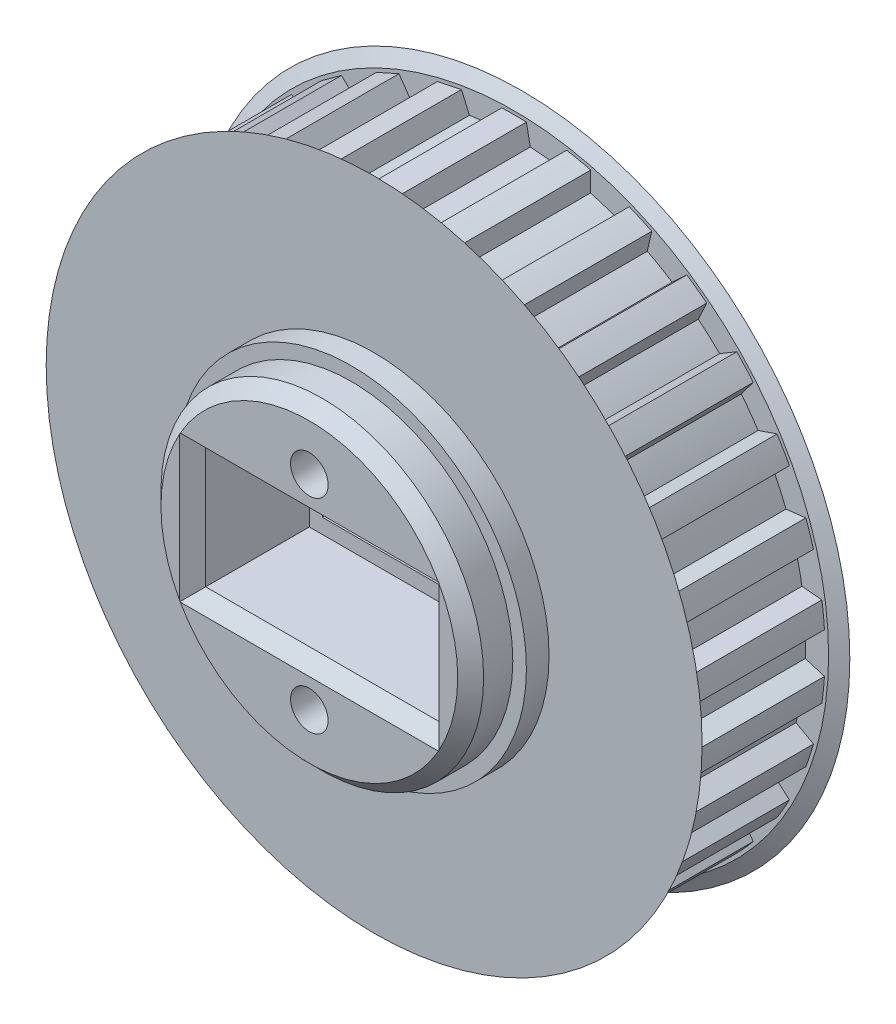
from build123d import *
from build123d.topology import SkipClean

# Parameters (mm, degrees)
CROQUIS1_R                 = 1.5
SALIENTE_EXTRUIR1_DEPTH    = 10.2
CROQUIS2_R                 = 26
CROQUIS2_R_2               = 1.5
SALIENTE_EXTRUIR2_DEPTH    = 0.6
SALIENTE_EXTRUIR4_START    = 4.25
CROQUIS4_R                 = 12.45
CROQUIS4_R_2               = 1.5
SALIENTE_EXTRUIR4_DEPTH    = 4.25
SALIENTE_EXTRUIR6_START    = 0.6
CROQUIS6_R                 = 26
CROQUIS6_R_2               = 1.5
SALIENTE_EXTRUIR6_DEPTH    = 0.6
SALIENTE_EXTRUIR5_START    = 1.75
CROQUIS5_R                 = 13.5
CROQUIS5_R_2               = 1.5
SALIENTE_EXTRUIR5_DEPTH    = 1.75
CHAFL_N2_SIZE              = 1.732050808
CHAFL_N2_SIZE_2            = 1
CROQUIS3_R                 = 12.45
CROQUIS3_R_2               = 1.5
SALIENTE_EXTRUIR7_DEPTH    = 5
CHAFL_N4_SIZE              = 1
CROQUIS7_R                 = 13.5
CROQUIS7_R_2               = 1.5
SALIENTE_EXTRUIR8_DEPTH    = 1.75
CORTAR_EXTRUIR1_DEPTH      = 40.122201962
CORTAR_EXTRUIR1_DEPTH_BACK = 40.122201962
CROQUIS8_R                 = 1.45
CROQUIS8_W                 = 16
CROQUIS8_H                 = 7
CROQUIS10_W                = 18
CROQUIS10_H                = 9.3
CORTAR_EXTRUIR3_DEPTH      = 9
CHAFL_N5_SIZE              = 1
SKETCH1_R                  = 12.45
SKETCH1_R_2                = 1.45
BOSS_EXTRUDE1_DEPTH        = 5
SKETCH2_R                  = 1.45
CUT_EXTRUDE1_DEPTH         = 42.023276154
SKETCH4_W                  = 8
SKETCH4_H                  = 7
CUT_EXTRUDE2_DEPTH         = 21
CHAMFER3_SIZE              = 1
CHAMFER2_SIZE              = 0.75


# Some blends are built 0.0001 mm under size
with BuildPart() as part:
    # Croquis1 → Saliente-Extruir1 (new body)
    with BuildSketch(Plane.XY):
        with BuildLine():
            Line((-0.95, 23.981190546), (-1.25, 22.465250945))
            ThreePointArc((-1.25, 22.465250945), (-2.351890424, 22.376742646), (-3.448103808, 22.234220925))
            Line((-3.448103808, 22.234220925), (-4.056729654, 23.654660102))
            Line((-4.056729654, 23.654660102), (-5.915210095, 23.259627889))
            Line((-5.915210095, 23.259627889), (-5.893472809, 21.714441698))
            ThreePointArc((-5.893472809, 21.714441698), (-6.952882373, 21.398771617), (-7.995508933, 21.031448759))
            Line((-7.995508933, 21.031448759), (-8.886160755, 22.294307503))
            Line((-8.886160755, 22.294307503), (-10.621897124, 21.521507881))
            Line((-10.621897124, 21.521507881), (-10.279372577, 20.014607151))
            ThreePointArc((-10.279372577, 20.014607151), (-11.25, 19.485571585), (-12.193471951, 18.909501362))
            Line((-12.193471951, 18.909501362), (-13.327223991, 19.959586687))
            Line((-13.327223991, 19.959586687), (-14.86435628, 18.842794707))
            Line((-14.86435628, 18.842794707), (-14.216014437, 17.440038232))
            ThreePointArc((-14.216014437, 17.440038232), (-15.055438643, 16.720758573), (-15.858521735, 15.961118018))
            Line((-15.858521735, 15.961118018), (-17.185823587, 16.752536155))
            Line((-17.185823587, 16.752536155), (-18.457171739, 15.340560987))
            Line((-18.457171739, 15.340560987), (-17.53134825, 14.103255955))
            ThreePointArc((-17.53134825, 14.103255955), (-18.202882373, 13.225168177), (-18.83047802, 12.315157227))
            Line((-18.83047802, 12.315157227), (-20.293320226, 12.813319407))
            ThreePointArc((-20.293320226, 12.813319407), (-20.784609691, 12), (-21.243320226, 11.167871139))
            Line((-21.243320226, 11.167871139), (-20.08047802, 10.150093718))
            ThreePointArc((-20.08047802, 10.150093718), (-20.554772797, 9.151574469), (-20.979452058, 8.13096497))
            Line((-20.979452058, 8.13096497), (-22.513901393, 8.314099115))
            ThreePointArc((-22.513901393, 8.314099115), (-22.825356391, 7.416407865), (-23.101033682, 6.507091734))
            Line((-23.101033682, 6.507091734), (-21.751994544, 5.753323679))
            ThreePointArc((-21.751994544, 5.753323679), (-22.008321017, 4.678013043), (-22.21152337, 3.591410527))
            Line((-22.21152337, 3.591410527), (-23.750517035, 3.451512796))
            ThreePointArc((-23.750517035, 3.451512796), (-23.868525489, 2.508683118), (-23.949121115, 1.561921194))
            Line((-23.949121115, 1.561921194), (-22.472844528, 1.105105789))
            ThreePointArc((-22.472844528, 1.105105789), (-22.5, 0), (-22.472844528, -1.105105789))
            Line((-22.472844528, -1.105105789), (-23.949121115, -1.561921194))
            ThreePointArc((-23.949121115, -1.561921194), (-23.868525489, -2.508683118), (-23.750517035, -3.451512796))
            Line((-23.750517035, -3.451512796), (-22.21152337, -3.591410527))
            ThreePointArc((-22.21152337, -3.591410527), (-22.008321017, -4.678013043), (-21.751994544, -5.753323679))
            Line((-21.751994544, -5.753323679), (-23.101033682, -6.507091734))
            ThreePointArc((-23.101033682, -6.507091734), (-22.825356391, -7.416407865), (-22.513901393, -8.314099115))
            Line((-22.513901393, -8.314099115), (-20.979452058, -8.13096497))
            ThreePointArc((-20.979452058, -8.13096497), (-20.554772797, -9.151574469), (-20.08047802, -10.150093718))
            Line((-20.08047802, -10.150093718), (-21.243320226, -11.167871139))
            ThreePointArc((-21.243320226, -11.167871139), (-20.784609691, -12), (-20.293320226, -12.813319407))
            Line((-20.293320226, -12.813319407), (-18.83047802, -12.315157227))
            ThreePointArc((-18.83047802, -12.315157227), (-18.202882373, -13.225168177), (-17.53134825, -14.103255955))
            Line((-17.53134825, -14.103255955), (-18.457171739, -15.340560987))
            ThreePointArc((-18.457171739, -15.340560987), (-17.835475811, -16.059134553), (-17.185823587, -16.752536155))
            Line((-17.185823587, -16.752536155), (-15.858521735, -15.961118018))
            ThreePointArc((-15.858521735, -15.961118018), (-15.055438643, -16.720758573), (-14.216014437, -17.440038232))
            Line((-14.216014437, -17.440038232), (-14.86435628, -18.842794707))
            ThreePointArc((-14.86435628, -18.842794707), (-14.106846055, -19.416407865), (-13.327223991, -19.959586687))
            Line((-13.327223991, -19.959586687), (-12.193471951, -18.909501362))
            ThreePointArc((-12.193471951, -18.909501362), (-11.25, -19.485571585), (-10.279372577, -20.014607151))
            Line((-10.279372577, -20.014607151), (-10.621897124, -21.521507881))
            ThreePointArc((-10.621897124, -21.521507881), (-9.761679434, -21.925090983), (-8.886160755, -22.294307503))
            Line((-8.886160755, -22.294307503), (-7.995508933, -21.031448759))
            ThreePointArc((-7.995508933, -21.031448759), (-6.952882373, -21.398771617), (-5.893472809, -21.714441698))
            Line((-5.893472809, -21.714441698), (-5.915210095, -23.259627889))
            ThreePointArc((-5.915210095, -23.259627889), (-4.98988058, -23.475542418), (-4.056729654, -23.654660102))
            Line((-4.056729654, -23.654660102), (-3.448103808, -22.234220925))
            ThreePointArc((-3.448103808, -22.234220925), (-2.351890424, -22.376742646), (-1.25, -22.465250945))
            Line((-1.25, -22.465250945), (-0.95, -23.981190546))
            ThreePointArc((-0.95, -23.981190546), (0, -24), (0.95, -23.981190546))
            Line((0.95, -23.981190546), (1.25, -22.465250945))
            ThreePointArc((1.25, -22.465250945), (2.351890424, -22.376742646), (3.448103808, -22.234220925))
            Line((3.448103808, -22.234220925), (4.056729654, -23.654660102))
            ThreePointArc((4.056729654, -23.654660102), (4.98988058, -23.475542418), (5.915210095, -23.259627889))
            Line((5.915210095, -23.259627889), (5.893472809, -21.714441698))
            ThreePointArc((5.893472809, -21.714441698), (6.952882373, -21.398771617), (7.995508933, -21.031448759))
            Line((7.995508933, -21.031448759), (8.886160755, -22.294307503))
            ThreePointArc((8.886160755, -22.294307503), (9.761679434, -21.925090983), (10.621897124, -21.521507881))
            Line((10.621897124, -21.521507881), (10.279372577, -20.014607151))
            ThreePointArc((10.279372577, -20.014607151), (11.25, -19.485571585), (12.193471951, -18.909501362))
            Line((12.193471951, -18.909501362), (13.327223991, -19.959586687))
            ThreePointArc((13.327223991, -19.959586687), (14.106846055, -19.416407865), (14.86435628, -18.842794707))
            Line((14.86435628, -18.842794707), (14.216014437, -17.440038232))
            ThreePointArc((14.216014437, -17.440038232), (15.055438643, -16.720758573), (15.858521735, -15.961118018))
            Line((15.858521735, -15.961118018), (17.185823587, -16.752536155))
            ThreePointArc((17.185823587, -16.752536155), (17.835475811, -16.059134553), (18.457171739, -15.340560987))
            Line((18.457171739, -15.340560987), (17.53134825, -14.103255955))
            ThreePointArc((17.53134825, -14.103255955), (18.202882373, -13.225168177), (18.83047802, -12.315157227))
            Line((18.83047802, -12.315157227), (20.293320226, -12.813319407))
            ThreePointArc((20.293320226, -12.813319407), (20.784609691, -12), (21.243320226, -11.167871139))
            Line((21.243320226, -11.167871139), (20.08047802, -10.150093718))
            ThreePointArc((20.08047802, -10.150093718), (20.554772797, -9.151574469), (20.979452058, -8.13096497))
            Line((20.979452058, -8.13096497), (22.513901393, -8.314099115))
            ThreePointArc((22.513901393, -8.314099115), (22.825356391, -7.416407865), (23.101033682, -6.507091734))
            Line((23.101033682, -6.507091734), (21.751994544, -5.753323679))
            ThreePointArc((21.751994544, -5.753323679), (22.008321017, -4.678013043), (22.21152337, -3.591410527))
            Line((22.21152337, -3.591410527), (23.750517035, -3.451512796))
            ThreePointArc((23.750517035, -3.451512796), (23.868525489, -2.508683118), (23.949121115, -1.561921194))
            Line((23.949121115, -1.561921194), (22.472844528, -1.105105789))
            ThreePointArc((22.472844528, -1.105105789), (22.5, 0), (22.472844528, 1.105105789))
            Line((22.472844528, 1.105105789), (23.949121115, 1.561921194))
            ThreePointArc((23.949121115, 1.561921194), (23.868525489, 2.508683118), (23.750517035, 3.451512796))
            Line((23.750517035, 3.451512796), (22.21152337, 3.591410527))
            ThreePointArc((22.21152337, 3.591410527), (22.008321017, 4.678013043), (21.751994544, 5.753323679))
            Line((21.751994544, 5.753323679), (23.101033682, 6.507091734))
            ThreePointArc((23.101033682, 6.507091734), (22.825356391, 7.416407865), (22.513901393, 8.314099115))
            Line((22.513901393, 8.314099115), (20.979452058, 8.13096497))
            ThreePointArc((20.979452058, 8.13096497), (20.554772797, 9.151574469), (20.08047802, 10.150093718))
            Line((20.08047802, 10.150093718), (21.243320226, 11.167871139))
            ThreePointArc((21.243320226, 11.167871139), (20.784609691, 12), (20.293320226, 12.813319407))
            Line((20.293320226, 12.813319407), (18.83047802, 12.315157227))
            ThreePointArc((18.83047802, 12.315157227), (18.202882373, 13.225168177), (17.53134825, 14.103255955))
            Line((17.53134825, 14.103255955), (18.457171739, 15.340560987))
            ThreePointArc((18.457171739, 15.340560987), (17.835475811, 16.059134553), (17.185823587, 16.752536155))
            Line((17.185823587, 16.752536155), (15.858521735, 15.961118018))
            ThreePointArc((15.858521735, 15.961118018), (15.055438643, 16.720758573), (14.216014437, 17.440038232))
            Line((14.216014437, 17.440038232), (14.86435628, 18.842794707))
            ThreePointArc((14.86435628, 18.842794707), (14.106846055, 19.416407865), (13.327223991, 19.959586687))
            Line((13.327223991, 19.959586687), (12.193471951, 18.909501362))
            ThreePointArc((12.193471951, 18.909501362), (11.25, 19.485571585), (10.279372577, 20.014607151))
            Line((10.279372577, 20.014607151), (10.621897124, 21.521507881))
            ThreePointArc((10.621897124, 21.521507881), (9.761679434, 21.925090983), (8.886160755, 22.294307503))
            Line((8.886160755, 22.294307503), (7.995508933, 21.031448759))
            ThreePointArc((7.995508933, 21.031448759), (6.952882373, 21.398771617), (5.893472809, 21.714441698))
            Line((5.893472809, 21.714441698), (5.915210095, 23.259627889))
            ThreePointArc((5.915210095, 23.259627889), (4.98988058, 23.475542418), (4.056729654, 23.654660102))
            Line((4.056729654, 23.654660102), (3.448103808, 22.234220925))
            ThreePointArc((3.448103808, 22.234220925), (2.351890424, 22.376742646), (1.25, 22.465250945))
            Line((1.25, 22.465250945), (0.95, 23.981190546))
            ThreePointArc((0.95, 23.981190546), (0, 24), (-0.95, 23.981190546))
        make_face()
        Circle(CROQUIS1_R, mode=Mode.SUBTRACT)
    extrude(amount=SALIENTE_EXTRUIR1_DEPTH)

    # Croquis2 → Saliente-Extruir2 (add)
    with BuildSketch(Plane.XY.offset(10.2)):
        Circle(CROQUIS2_R)
        Circle(CROQUIS2_R_2, mode=Mode.SUBTRACT)
    extrude(amount=SALIENTE_EXTRUIR2_DEPTH)

    # Croquis4 → Saliente-Extruir4 (add)
    with BuildSketch(Plane(origin=(0, 0, 0), x_dir=(-1, 0, 0), z_dir=(0, 0, -1)).offset(SALIENTE_EXTRUIR4_START)):
        with Locations(Location((0, 0, 0), (0, 0, 180))):
            Circle(CROQUIS4_R)
        Circle(CROQUIS4_R_2, mode=Mode.SUBTRACT)
    extrude(amount=-SALIENTE_EXTRUIR4_DEPTH)

    # Croquis6 → Saliente-Extruir6 (add)
    with SkipClean():  # the faces are left unmerged after this step: merging them gives an invalid solid
        with BuildSketch(Plane(origin=(0, 0, 0), x_dir=(-1, 0, 0), z_dir=(0, 0, -1)).offset(SALIENTE_EXTRUIR6_START)):
            with Locations(Location((0, 0, 0), (0, 0, 180))):
                Circle(CROQUIS6_R)
            Circle(CROQUIS6_R_2, mode=Mode.SUBTRACT)
        extrude(amount=-SALIENTE_EXTRUIR6_DEPTH)

    # Croquis5 → Saliente-Extruir5 (add)
    with SkipClean():  # the faces are left unmerged after this step: merging them gives an invalid solid
        with BuildSketch(Plane(origin=(0, 0, -0.6), x_dir=(-1, 0, 0), z_dir=(0, 0, -1)).offset(SALIENTE_EXTRUIR5_START)):
            Circle(CROQUIS5_R)
            Circle(CROQUIS5_R_2, mode=Mode.SUBTRACT)
        extrude(amount=-SALIENTE_EXTRUIR5_DEPTH)

    # Chaflán2
    # the kernel refuses this chamfer: 1.732050808, 1 mm, written as the material it takes off along each edge
    with BuildSketch(Plane(origin=(0, 0, 0), x_dir=(1, 0, 0), z_dir=(0, 1, 0))) as chafl_n2_piece_1:
        Polygon((26 - CHAFL_N2_SIZE, 0), (26, CHAFL_N2_SIZE_2), (26, 0), align=None)
    revolve(axis=Axis((0, 0, 0), (0, 0, -1)), mode=Mode.SUBTRACT)
    with BuildSketch(Plane(origin=(0, 0, 10.2), x_dir=(1, 0, 0), z_dir=(0, -1, 0))) as chafl_n2_piece_2:
        Polygon((26 - CHAFL_N2_SIZE, 0), (26, CHAFL_N2_SIZE_2), (26, 0), align=None)
    revolve(axis=Axis((0, 0, 10.2), (0, 0, 1)), mode=Mode.SUBTRACT)

    # Croquis3 → Saliente-Extruir7 (add)
    with BuildSketch(Plane.XY.offset(10.8)):
        with Locations(Location((0, 0, 0), (0, 0, 180))):
            Circle(CROQUIS3_R)
        with Locations(Location((0, 0, 0), (0, 0, 180))):
            Circle(CROQUIS3_R_2, mode=Mode.SUBTRACT)
    extrude(amount=SALIENTE_EXTRUIR7_DEPTH)

    # Chaflán4
    chafl_n4_edges = [part.edges().sort_by_distance(p)[0] for p in [
        (12.45, 0, 15.8),
    ]]
    chamfer(chafl_n4_edges, length=CHAFL_N4_SIZE)

    # Croquis7 → Saliente-Extruir8 (add)
    with BuildSketch(Plane.XY.offset(10.8)):
        with Locations(Location((0, 0, 0), (0, 0, 180))):
            Circle(CROQUIS7_R)
        with Locations(Location((0, 0, 0), (0, 0, 180))):
            Circle(CROQUIS7_R_2, mode=Mode.SUBTRACT)
    extrude(amount=SALIENTE_EXTRUIR8_DEPTH)

    # Croquis8 → Cortar-Extruir1 (cut, two sides: drawn at the far end of the back side and taken through both)
    with BuildSketch(Plane.XY.offset(-CORTAR_EXTRUIR1_DEPTH_BACK)):
        with Locations((0, 7.875631857)):
            Circle(CROQUIS8_R)
        with Locations((0, -7.875631857)):
            Circle(CROQUIS8_R)
        Rectangle(CROQUIS8_W, CROQUIS8_H)
    extrude(amount=CORTAR_EXTRUIR1_DEPTH + CORTAR_EXTRUIR1_DEPTH_BACK, mode=Mode.SUBTRACT)

    # Croquis10 → Cortar-Extruir3 (cut)
    with BuildSketch(Plane.XY.offset(15.8)):
        Rectangle(CROQUIS10_W, CROQUIS10_H)
    extrude(amount=-CORTAR_EXTRUIR3_DEPTH, mode=Mode.SUBTRACT)

    # Chaflán5
    # the kernel refuses this chamfer: 1 mm, written as the material it takes off along each edge
    with BuildSketch(Plane(origin=(8, 3.5, -4.25), x_dir=(0.9996219169112968, 0, -0.02749587661058651), z_dir=(0, -1, 0)), Plane(origin=(-8, -3.5, -4.25), x_dir=(-0.9996219169112968, 0, -0.02749587661058651), z_dir=(0, 1, 0))) as chafl_n5_piece_1:
        Polygon((CHAFL_N5_SIZE * 0.999621916911, CHAFL_N5_SIZE * 0.0274958766106), (-CHAFL_N5_SIZE * 0.0274958766106, CHAFL_N5_SIZE * 0.999621916911), (0, 0), align=None)
    extrude(amount=7, mode=Mode.SUBTRACT)
    with BuildSketch(Plane(origin=(8, -3.5, -4.25), x_dir=(0, -0.9996219169112968, -0.027495876610586497), z_dir=(-1, 0, 0)), Plane(origin=(-8, 3.5, -4.25), x_dir=(0, 0.9996219169112968, -0.027495876610586487), z_dir=(1, 0, 0))) as chafl_n5_piece_2:
        Polygon((CHAFL_N5_SIZE * 0.999621916911, CHAFL_N5_SIZE * 0.0274958766106), (-CHAFL_N5_SIZE * 0.0274958766106, CHAFL_N5_SIZE * 0.999621916911), (0, 0), align=None)
    extrude(amount=16, mode=Mode.SUBTRACT)
    with BuildSketch(Plane(origin=(-9, 4.65, 15.8), x_dir=(-0.9996219169112968, 0, 0.027495876610585647), z_dir=(0, -1, 0)), Plane(origin=(9, -4.65, 15.8), x_dir=(0.9996219169112968, 0, 0.027495876610585647), z_dir=(0, 1, 0))) as chafl_n5_piece_3:
        Polygon((CHAFL_N5_SIZE * 0.999621916911, CHAFL_N5_SIZE * 0.0274958766106), (-CHAFL_N5_SIZE * 0.0274958766106, CHAFL_N5_SIZE * 0.999621916911), (0, 0), align=None)
    extrude(amount=9.3, mode=Mode.SUBTRACT)
    with BuildSketch(Plane(origin=(-9, -4.65, 15.8), x_dir=(0, -0.9996219169112968, 0.027495876610585623), z_dir=(1, 0, 0)), Plane(origin=(9, 4.65, 15.8), x_dir=(0, 0.9996219169112968, 0.027495876610585623), z_dir=(-1, 0, 0))) as chafl_n5_piece_4:
        Polygon((CHAFL_N5_SIZE * 0.999621916911, CHAFL_N5_SIZE * 0.0274958766106), (-CHAFL_N5_SIZE * 0.0274958766106, CHAFL_N5_SIZE * 0.999621916911), (0, 0), align=None)
    extrude(amount=18, mode=Mode.SUBTRACT)
    with BuildSketch(Plane(origin=(-8, 3.5, -4.25), x_dir=(0, 0.9996219169112968, -0.027495876610586487), z_dir=(1, 0, 0))) as chafl_n5_piece_5a_section:
        Polygon((CHAFL_N5_SIZE * 0.999621916911, CHAFL_N5_SIZE * 0.0274958766106), (-CHAFL_N5_SIZE * 0.0274958766106, CHAFL_N5_SIZE * 0.999621916911), (0, 0), align=None)
    chafl_n5_piece_5a = extrude(amount=18.571682988, mode=Mode.PRIVATE)
    chafl_n5_piece_5a = split(chafl_n5_piece_5a, bisect_by=Plane(origin=(8, 3.829793627, -3.920206373), z_dir=(1, 0, 0)), keep=Keep.TOP, mode=Mode.PRIVATE)
    with BuildSketch(Plane(origin=(8, 6.071682988, -4.25), x_dir=(0.9996219169112968, 0, -0.02749587661058651), z_dir=(0, -1, 0))) as chafl_n5_piece_5b_section:
        Polygon((CHAFL_N5_SIZE * 0.999621916911, CHAFL_N5_SIZE * 0.0274958766106), (-CHAFL_N5_SIZE * 0.0274958766106, CHAFL_N5_SIZE * 0.999621916911), (0, 0), align=None)
    chafl_n5_piece_5b = extrude(amount=9.571682988, mode=Mode.PRIVATE)
    chafl_n5_piece_5b = split(chafl_n5_piece_5b, bisect_by=Plane(origin=(8.329793627, 3.5, -3.920206373), z_dir=(0, 1, 0)), keep=Keep.TOP, mode=Mode.PRIVATE)
    chafl_n5_piece_5 = chafl_n5_piece_5a & chafl_n5_piece_5b
    add(chafl_n5_piece_5, mode=Mode.SUBTRACT)
    with BuildSketch(Plane(origin=(8, 3.5, -4.25), x_dir=(0.9996219169112968, 0, -0.02749587661058651), z_dir=(0, -1, 0))) as chafl_n5_piece_6a_section:
        Polygon((CHAFL_N5_SIZE * 0.999621916911, CHAFL_N5_SIZE * 0.0274958766106), (-CHAFL_N5_SIZE * 0.0274958766106, CHAFL_N5_SIZE * 0.999621916911), (0, 0), align=None)
    chafl_n5_piece_6a = extrude(amount=9.571682988, mode=Mode.PRIVATE)
    chafl_n5_piece_6a = split(chafl_n5_piece_6a, bisect_by=Plane(origin=(8.329793627, -3.5, -3.920206373), z_dir=(0, -1, 0)), keep=Keep.TOP, mode=Mode.PRIVATE)
    with BuildSketch(Plane(origin=(10.571682988, -3.5, -4.25), x_dir=(0, -0.9996219169112968, -0.027495876610586497), z_dir=(-1, 0, 0))) as chafl_n5_piece_6b_section:
        Polygon((CHAFL_N5_SIZE * 0.999621916911, CHAFL_N5_SIZE * 0.0274958766106), (-CHAFL_N5_SIZE * 0.0274958766106, CHAFL_N5_SIZE * 0.999621916911), (0, 0), align=None)
    chafl_n5_piece_6b = extrude(amount=18.571682988, mode=Mode.PRIVATE)
    chafl_n5_piece_6b = split(chafl_n5_piece_6b, bisect_by=Plane(origin=(8, -3.829793627, -3.920206373), z_dir=(1, 0, 0)), keep=Keep.TOP, mode=Mode.PRIVATE)
    chafl_n5_piece_6 = chafl_n5_piece_6a & chafl_n5_piece_6b
    add(chafl_n5_piece_6, mode=Mode.SUBTRACT)
    with BuildSketch(Plane(origin=(8, -3.5, -4.25), x_dir=(0, -0.9996219169112968, -0.027495876610586497), z_dir=(-1, 0, 0))) as chafl_n5_piece_7a_section:
        Polygon((CHAFL_N5_SIZE * 0.999621916911, CHAFL_N5_SIZE * 0.0274958766106), (-CHAFL_N5_SIZE * 0.0274958766106, CHAFL_N5_SIZE * 0.999621916911), (0, 0), align=None)
    chafl_n5_piece_7a = extrude(amount=18.571682988, mode=Mode.PRIVATE)
    chafl_n5_piece_7a = split(chafl_n5_piece_7a, bisect_by=Plane(origin=(-8, -3.829793627, -3.920206373), z_dir=(-1, 0, 0)), keep=Keep.TOP, mode=Mode.PRIVATE)
    with BuildSketch(Plane(origin=(-8, -6.071682988, -4.25), x_dir=(-0.9996219169112968, 0, -0.02749587661058651), z_dir=(0, 1, 0))) as chafl_n5_piece_7b_section:
        Polygon((CHAFL_N5_SIZE * 0.999621916911, CHAFL_N5_SIZE * 0.0274958766106), (-CHAFL_N5_SIZE * 0.0274958766106, CHAFL_N5_SIZE * 0.999621916911), (0, 0), align=None)
    chafl_n5_piece_7b = extrude(amount=9.571682988, mode=Mode.PRIVATE)
    chafl_n5_piece_7b = split(chafl_n5_piece_7b, bisect_by=Plane(origin=(-8.329793627, -3.5, -3.920206373), z_dir=(0, -1, 0)), keep=Keep.TOP, mode=Mode.PRIVATE)
    chafl_n5_piece_7 = chafl_n5_piece_7a & chafl_n5_piece_7b
    add(chafl_n5_piece_7, mode=Mode.SUBTRACT)
    with BuildSketch(Plane(origin=(-10.571682988, 3.5, -4.25), x_dir=(0, 0.9996219169112968, -0.027495876610586487), z_dir=(1, 0, 0))) as chafl_n5_piece_8a_section:
        Polygon((CHAFL_N5_SIZE * 0.999621916911, CHAFL_N5_SIZE * 0.0274958766106), (-CHAFL_N5_SIZE * 0.0274958766106, CHAFL_N5_SIZE * 0.999621916911), (0, 0), align=None)
    chafl_n5_piece_8a = extrude(amount=18.571682988, mode=Mode.PRIVATE)
    chafl_n5_piece_8a = split(chafl_n5_piece_8a, bisect_by=Plane(origin=(-8, 3.829793627, -3.920206373), z_dir=(-1, 0, 0)), keep=Keep.TOP, mode=Mode.PRIVATE)
    with BuildSketch(Plane(origin=(-8, -3.5, -4.25), x_dir=(-0.9996219169112968, 0, -0.02749587661058651), z_dir=(0, 1, 0))) as chafl_n5_piece_8b_section:
        Polygon((CHAFL_N5_SIZE * 0.999621916911, CHAFL_N5_SIZE * 0.0274958766106), (-CHAFL_N5_SIZE * 0.0274958766106, CHAFL_N5_SIZE * 0.999621916911), (0, 0), align=None)
    chafl_n5_piece_8b = extrude(amount=9.571682988, mode=Mode.PRIVATE)
    chafl_n5_piece_8b = split(chafl_n5_piece_8b, bisect_by=Plane(origin=(-8.329793627, 3.5, -3.920206373), z_dir=(0, 1, 0)), keep=Keep.TOP, mode=Mode.PRIVATE)
    chafl_n5_piece_8 = chafl_n5_piece_8a & chafl_n5_piece_8b
    add(chafl_n5_piece_8, mode=Mode.SUBTRACT)
    with BuildSketch(Plane(origin=(9, 4.65, 15.8), x_dir=(0, 0.9996219169112968, 0.027495876610585623), z_dir=(-1, 0, 0))) as chafl_n5_piece_9a_section:
        Polygon((CHAFL_N5_SIZE * 0.999621916911, CHAFL_N5_SIZE * 0.0274958766106), (-CHAFL_N5_SIZE * 0.0274958766106, CHAFL_N5_SIZE * 0.999621916911), (0, 0), align=None)
    chafl_n5_piece_9a = extrude(amount=20.571682988, mode=Mode.PRIVATE)
    chafl_n5_piece_9a = split(chafl_n5_piece_9a, bisect_by=Plane(origin=(-9, 4.979793627, 15.470206373), z_dir=(-1, 0, 0)), keep=Keep.TOP, mode=Mode.PRIVATE)
    with BuildSketch(Plane(origin=(-9, 7.221682988, 15.8), x_dir=(-0.9996219169112968, 0, 0.027495876610585647), z_dir=(0, -1, 0))) as chafl_n5_piece_9b_section:
        Polygon((CHAFL_N5_SIZE * 0.999621916911, CHAFL_N5_SIZE * 0.0274958766106), (-CHAFL_N5_SIZE * 0.0274958766106, CHAFL_N5_SIZE * 0.999621916911), (0, 0), align=None)
    chafl_n5_piece_9b = extrude(amount=11.871682988, mode=Mode.PRIVATE)
    chafl_n5_piece_9b = split(chafl_n5_piece_9b, bisect_by=Plane(origin=(-9.329793627, 4.65, 15.470206373), z_dir=(0, 1, 0)), keep=Keep.TOP, mode=Mode.PRIVATE)
    chafl_n5_piece_9 = chafl_n5_piece_9a & chafl_n5_piece_9b
    add(chafl_n5_piece_9, mode=Mode.SUBTRACT)
    with BuildSketch(Plane(origin=(-9, 4.65, 15.8), x_dir=(-0.9996219169112968, 0, 0.027495876610585647), z_dir=(0, -1, 0))) as chafl_n5_piece_10a_section:
        Polygon((CHAFL_N5_SIZE * 0.999621916911, CHAFL_N5_SIZE * 0.0274958766106), (-CHAFL_N5_SIZE * 0.0274958766106, CHAFL_N5_SIZE * 0.999621916911), (0, 0), align=None)
    chafl_n5_piece_10a = extrude(amount=11.871682988, mode=Mode.PRIVATE)
    chafl_n5_piece_10a = split(chafl_n5_piece_10a, bisect_by=Plane(origin=(-9.329793627, -4.65, 15.470206373), z_dir=(0, -1, 0)), keep=Keep.TOP, mode=Mode.PRIVATE)
    with BuildSketch(Plane(origin=(-11.571682988, -4.65, 15.8), x_dir=(0, -0.9996219169112968, 0.027495876610585623), z_dir=(1, 0, 0))) as chafl_n5_piece_10b_section:
        Polygon((CHAFL_N5_SIZE * 0.999621916911, CHAFL_N5_SIZE * 0.0274958766106), (-CHAFL_N5_SIZE * 0.0274958766106, CHAFL_N5_SIZE * 0.999621916911), (0, 0), align=None)
    chafl_n5_piece_10b = extrude(amount=20.571682988, mode=Mode.PRIVATE)
    chafl_n5_piece_10b = split(chafl_n5_piece_10b, bisect_by=Plane(origin=(-9, -4.979793627, 15.470206373), z_dir=(-1, 0, 0)), keep=Keep.TOP, mode=Mode.PRIVATE)
    chafl_n5_piece_10 = chafl_n5_piece_10a & chafl_n5_piece_10b
    add(chafl_n5_piece_10, mode=Mode.SUBTRACT)
    with BuildSketch(Plane(origin=(-9, -4.65, 15.8), x_dir=(0, -0.9996219169112968, 0.027495876610585623), z_dir=(1, 0, 0))) as chafl_n5_piece_11a_section:
        Polygon((CHAFL_N5_SIZE * 0.999621916911, CHAFL_N5_SIZE * 0.0274958766106), (-CHAFL_N5_SIZE * 0.0274958766106, CHAFL_N5_SIZE * 0.999621916911), (0, 0), align=None)
    chafl_n5_piece_11a = extrude(amount=20.571682988, mode=Mode.PRIVATE)
    chafl_n5_piece_11a = split(chafl_n5_piece_11a, bisect_by=Plane(origin=(9, -4.979793627, 15.470206373), z_dir=(1, 0, 0)), keep=Keep.TOP, mode=Mode.PRIVATE)
    with BuildSketch(Plane(origin=(9, -7.221682988, 15.8), x_dir=(0.9996219169112968, 0, 0.027495876610585647), z_dir=(0, 1, 0))) as chafl_n5_piece_11b_section:
        Polygon((CHAFL_N5_SIZE * 0.999621916911, CHAFL_N5_SIZE * 0.0274958766106), (-CHAFL_N5_SIZE * 0.0274958766106, CHAFL_N5_SIZE * 0.999621916911), (0, 0), align=None)
    chafl_n5_piece_11b = extrude(amount=11.871682988, mode=Mode.PRIVATE)
    chafl_n5_piece_11b = split(chafl_n5_piece_11b, bisect_by=Plane(origin=(9.329793627, -4.65, 15.470206373), z_dir=(0, -1, 0)), keep=Keep.TOP, mode=Mode.PRIVATE)
    chafl_n5_piece_11 = chafl_n5_piece_11a & chafl_n5_piece_11b
    add(chafl_n5_piece_11, mode=Mode.SUBTRACT)
    with BuildSketch(Plane(origin=(11.571682988, 4.65, 15.8), x_dir=(0, 0.9996219169112968, 0.027495876610585623), z_dir=(-1, 0, 0))) as chafl_n5_piece_12a_section:
        Polygon((CHAFL_N5_SIZE * 0.999621916911, CHAFL_N5_SIZE * 0.0274958766106), (-CHAFL_N5_SIZE * 0.0274958766106, CHAFL_N5_SIZE * 0.999621916911), (0, 0), align=None)
    chafl_n5_piece_12a = extrude(amount=20.571682988, mode=Mode.PRIVATE)
    chafl_n5_piece_12a = split(chafl_n5_piece_12a, bisect_by=Plane(origin=(9, 4.979793627, 15.470206373), z_dir=(1, 0, 0)), keep=Keep.TOP, mode=Mode.PRIVATE)
    with BuildSketch(Plane(origin=(9, -4.65, 15.8), x_dir=(0.9996219169112968, 0, 0.027495876610585647), z_dir=(0, 1, 0))) as chafl_n5_piece_12b_section:
        Polygon((CHAFL_N5_SIZE * 0.999621916911, CHAFL_N5_SIZE * 0.0274958766106), (-CHAFL_N5_SIZE * 0.0274958766106, CHAFL_N5_SIZE * 0.999621916911), (0, 0), align=None)
    chafl_n5_piece_12b = extrude(amount=11.871682988, mode=Mode.PRIVATE)
    chafl_n5_piece_12b = split(chafl_n5_piece_12b, bisect_by=Plane(origin=(9.329793627, 4.65, 15.470206373), z_dir=(0, 1, 0)), keep=Keep.TOP, mode=Mode.PRIVATE)
    chafl_n5_piece_12 = chafl_n5_piece_12a & chafl_n5_piece_12b
    add(chafl_n5_piece_12, mode=Mode.SUBTRACT)

    # Sketch1 → Boss-Extrude1 (add)
    with BuildSketch(Plane(origin=(0, 0, -4.25), x_dir=(-1, 0, 0), z_dir=(0, 0, -1))):
        Circle(SKETCH1_R)
        with Locations(Location((0, 7.875631857, 0), (0, 0, 180))):
            Circle(SKETCH1_R_2, mode=Mode.SUBTRACT)
        with Locations(Location((0, -7.875631857, 0), (0, 0, 180))):
            Circle(SKETCH1_R_2, mode=Mode.SUBTRACT)
    extrude(amount=-BOSS_EXTRUDE1_DEPTH)

    # Sketch2 → Cut-Extrude1 (cut, through all)
    with BuildSketch(Plane(origin=(0, 0, -4.25), x_dir=(-1, 0, 0), z_dir=(0, 0, -1))):
        with Locations((-7.5, 0)):
            Circle(SKETCH2_R)
        with Locations(Location((7.5, 0, 0), (0, 0, 69.828728654))):
            Circle(SKETCH2_R)
    extrude(amount=-CUT_EXTRUDE1_DEPTH, mode=Mode.SUBTRACT)

    # Sketch4 → Cut-Extrude2 (cut)
    with BuildSketch(Plane.XY.offset(15.8)):
        Rectangle(SKETCH4_W, SKETCH4_H)
    extrude(amount=-CUT_EXTRUDE2_DEPTH, mode=Mode.SUBTRACT)

    # Chamfer3
    chamfer3_edges = [part.edges().sort_by_distance(p)[0] for p in [
        (-4, 0, -4.25),
        (0, 3.5, -4.25),
        (4, 0, -4.25),
        (0, -3.5, -4.25),
    ]]
    chamfer(chamfer3_edges, length=CHAMFER3_SIZE - 0.0001)  # a hair under: the kernel refuses the full size

    # Chamfer2
    chamfer2_edges = [part.edges().sort_by_distance(p)[0] for p in [
        (-12.45, 0, -4.25),
    ]]
    chamfer(chamfer2_edges, length=CHAMFER2_SIZE)


solid = part.part
